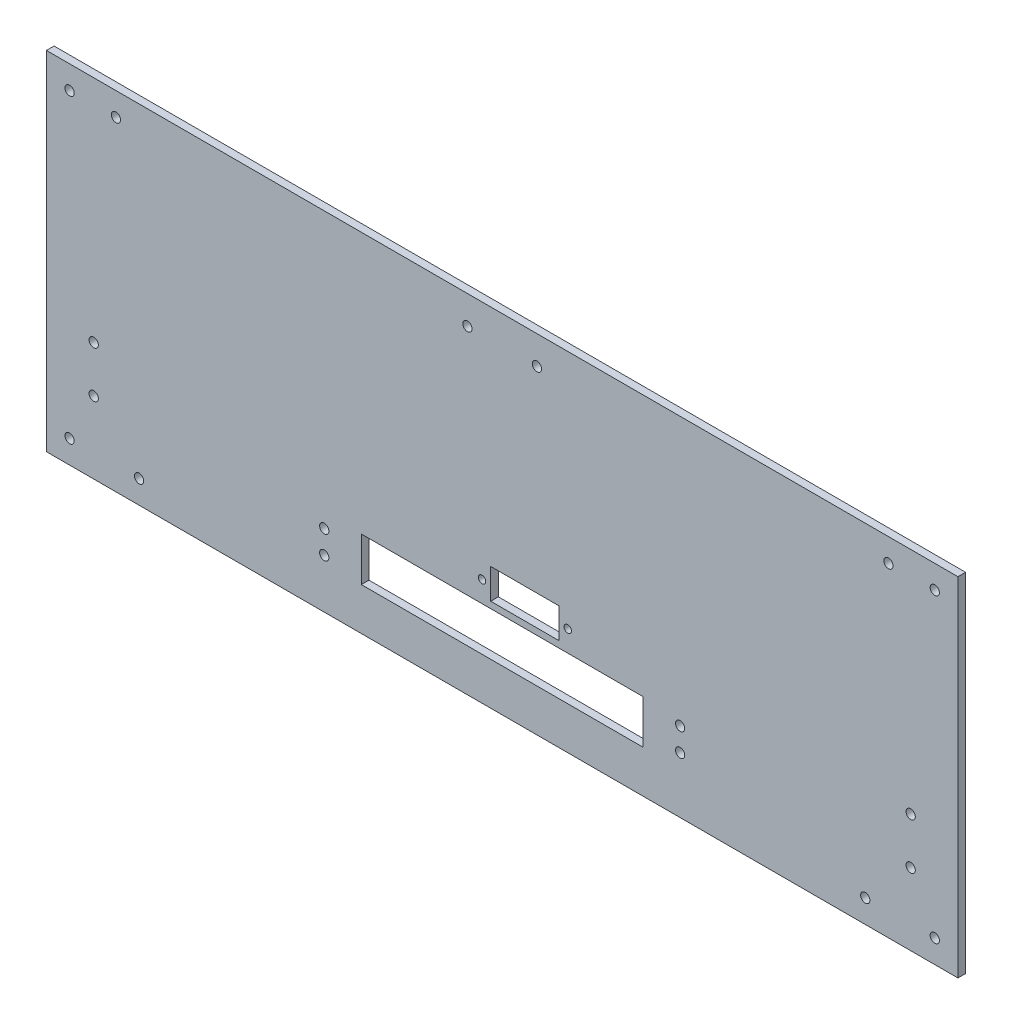
from build123d import *

# Parameters (mm, degrees)
SKETCH1_W           = 393.4
SKETCH1_H           = 150
BOSS_EXTRUDE1_DEPTH = 3.3
SKETCH2_R           = 2
CUT_EXTRUDE1_DEPTH  = 257.520622953
SKETCH3_R           = 2
CUT_EXTRUDE2_DEPTH  = 4
SKETCH4_R           = 2
CUT_EXTRUDE3_DEPTH  = 4
SKETCH6_W           = 29.5
SKETCH6_H           = 13
SKETCH6_W_2         = 121.579447476
SKETCH6_H_2         = 18.9
CUT_EXTRUDE4_DEPTH  = 10
SKETCH7_R           = 2
SKETCH7_R_2         = 1.6
CUT_EXTRUDE5_DEPTH  = 10


with BuildPart() as part:
    # Sketch1 → Boss-Extrude1 (new body)
    with BuildSketch(Plane.XY):
        with Locations((27, -50.5)):
            Rectangle(SKETCH1_W, SKETCH1_H)
    extrude(amount=BOSS_EXTRUDE1_DEPTH)

    # Sketch2 → Cut-Extrude1 (cut, through all)
    with BuildSketch(Plane(origin=(0, 0, 0), x_dir=(-1, 0, 0), z_dir=(0, 0, -1))):
        with Locations((-183.7, -115.5)):
            Circle(SKETCH2_R)
        with Locations((-213.7, -115.5)):
            Circle(SKETCH2_R)
        with Locations((129.7, -115.5)):
            Circle(SKETCH2_R)
        with Locations((159.7, -115.5)):
            Circle(SKETCH2_R)
    extrude(amount=-CUT_EXTRUDE1_DEPTH, mode=Mode.SUBTRACT)

    # Sketch3 → Cut-Extrude2 (cut)
    with BuildSketch(Plane.XY.offset(3.3)):
        with Locations((-159.7, 14.5)):
            Circle(SKETCH3_R)
        with Locations((-139.7, 14.5)):
            Circle(SKETCH3_R)
        with Locations((193.7, 14.5)):
            Circle(SKETCH3_R)
        with Locations((213.7, 14.5)):
            Circle(SKETCH3_R)
    extrude(amount=-CUT_EXTRUDE2_DEPTH, mode=Mode.SUBTRACT)

    # Sketch4 → Cut-Extrude3 (cut)
    with BuildSketch(Plane.XY.offset(3.3)):
        with Locations((12, 12.25)):
            Circle(SKETCH4_R)
        with Locations((42, 12.25)):
            Circle(SKETCH4_R)
    extrude(amount=-CUT_EXTRUDE3_DEPTH, mode=Mode.SUBTRACT)

    # Sketch6 → Cut-Extrude4 (cut)
    with BuildSketch(Plane(origin=(0, 0, 0), x_dir=(-1, 0, 0), z_dir=(0, 0, -1))):
        with Locations((-36.8, -79)):
            Rectangle(SKETCH6_W, SKETCH6_H)
        with Locations((-27, -97.742382112)):
            Rectangle(SKETCH6_W_2, SKETCH6_H_2)
    extrude(amount=-CUT_EXTRUDE4_DEPTH, mode=Mode.SUBTRACT)

    # Sketch7 → Cut-Extrude5 (cut)
    with BuildSketch(Plane.XY.offset(3.3)):
        with Locations((-149.298074337, -74.431790876)):
            Circle(SKETCH7_R)
        with Locations((-149.298074337, -94.431790876)):
            Circle(SKETCH7_R)
        with Locations((-49.797853771, -104.242382112)):
            Circle(SKETCH7_R)
        with Locations((-49.797853771, -94.242382112)):
            Circle(SKETCH7_R)
        with Locations((18.3, -79.226876468)):
            Circle(SKETCH7_R_2)
        with Locations((55.3, -79.226876468)):
            Circle(SKETCH7_R_2)
        with Locations((103.797853771, -91.242382112)):
            Circle(SKETCH7_R)
        with Locations((103.797853771, -101.242382112)):
            Circle(SKETCH7_R)
        with Locations((203.298074337, -74.45)):
            Circle(SKETCH7_R)
        with Locations((203.298074337, -94.45)):
            Circle(SKETCH7_R)
    extrude(amount=-CUT_EXTRUDE5_DEPTH, mode=Mode.SUBTRACT)


solid = part.part
